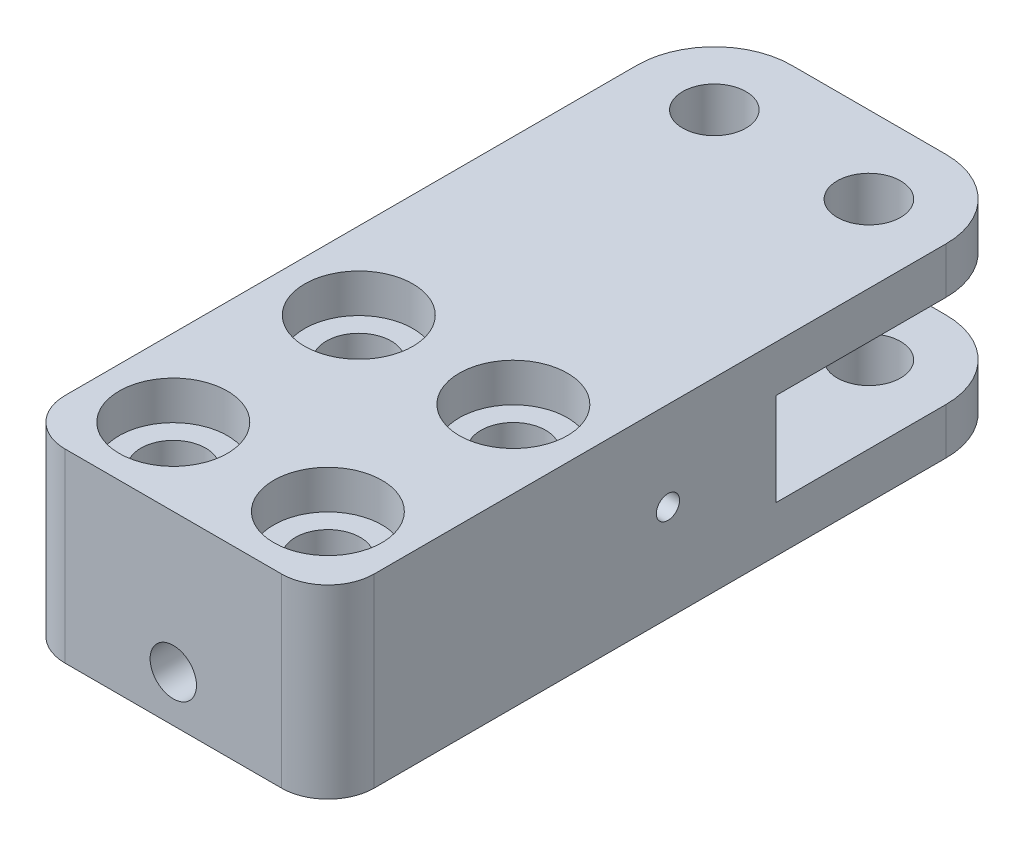
from build123d import *

# Parameters (mm, degrees)
BOSS_EXTRUDE1_START = 11
SKETCH1_W           = 20
SKETCH1_H           = 45
BOSS_EXTRUDE1_DEPTH = 12
SKETCH2_R           = 2.1
CUT_EXTRUDE1_DEPTH  = 16
SKETCH3_W           = 16
SKETCH3_H           = 6
CUT_EXTRUDE2_DEPTH  = 20
SKETCH4_R           = 2.05
CUT_EXTRUDE3_DEPTH  = 13
FILLET1_R           = 5
SKETCH5_R           = 3.5
CUT_EXTRUDE4_DEPTH  = 2.5
FILLET2_R           = 3
SKETCH6_W           = 3.5
SKETCH6_H           = 17
CUT_EXTRUDE5_DEPTH  = 9
SKETCH7_R           = 0.75
CUT_EXTRUDE6_DEPTH  = 20
SKETCH8_R           = 1.5
CUT_EXTRUDE7_DEPTH  = 18


with BuildPart() as part:
    # Sketch1 → Boss-Extrude1 (new body)
    with BuildSketch(Plane(origin=(0, 0, 0), x_dir=(1, 0, 0), z_dir=(0, 1, 0)).offset(BOSS_EXTRUDE1_START)):
        with Locations((0, -544.5)):
            Rectangle(SKETCH1_W, SKETCH1_H)
    extrude(amount=BOSS_EXTRUDE1_DEPTH)

    # Sketch2 → Cut-Extrude1 (cut)
    with BuildSketch(Plane(origin=(0, 23, 0), x_dir=(1, 0, 0), z_dir=(0, 1, 0))):
        with Locations((-5, -562)):
            Circle(SKETCH2_R)
        with Locations((5, -562)):
            Circle(SKETCH2_R)
        with Locations((-5, -550)):
            Circle(SKETCH2_R)
        with Locations((5, -550)):
            Circle(SKETCH2_R)
    extrude(amount=-CUT_EXTRUDE1_DEPTH, mode=Mode.SUBTRACT)

    # Sketch3 → Cut-Extrude2 (cut)
    with BuildSketch(Plane(origin=(10, 0, 0), x_dir=(0, 0, -1), z_dir=(1, 0, 0))):
        with Locations((-530, 17)):
            Rectangle(SKETCH3_W, SKETCH3_H)
    extrude(amount=-CUT_EXTRUDE2_DEPTH, mode=Mode.SUBTRACT)

    # Sketch4 → Cut-Extrude3 (cut)
    with BuildSketch(Plane(origin=(0, 23, 0), x_dir=(1, 0, 0), z_dir=(0, 1, 0))):
        with Locations((-5, -527)):
            Circle(SKETCH4_R)
        with Locations((5, -527)):
            Circle(SKETCH4_R)
    extrude(amount=-CUT_EXTRUDE3_DEPTH, mode=Mode.SUBTRACT)

    # Fillet1
    fillet1_edges = [part.edges().sort_by_distance(p)[0] for p in [
        (10, 12.5, 522),
        (10, 21.5, 522),
        (-10, 12.5, 522),
        (-10, 21.5, 522),
    ]]
    fillet(fillet1_edges, radius=FILLET1_R)

    # Sketch5 → Cut-Extrude4 (cut)
    with BuildSketch(Plane(origin=(0, 23, 0), x_dir=(1, 0, 0), z_dir=(0, 1, 0))):
        with Locations((-5, -550)):
            Circle(SKETCH5_R)
        with Locations((5, -550)):
            Circle(SKETCH5_R)
        with Locations((-5, -562)):
            Circle(SKETCH5_R)
        with Locations((5, -562)):
            Circle(SKETCH5_R)
    extrude(amount=-CUT_EXTRUDE4_DEPTH, mode=Mode.SUBTRACT)

    # Fillet2
    fillet2_edges = [part.edges().sort_by_distance(p)[0] for p in [
        (10, 17, 567),
        (-10, 17, 567),
    ]]
    fillet(fillet2_edges, radius=FILLET2_R)

    # Sketch6 → Cut-Extrude5 (cut)
    with BuildSketch(Plane.XZ.offset(-11)):
        with Locations((0, 540.5)):
            Rectangle(SKETCH6_W, SKETCH6_H)
    extrude(amount=-CUT_EXTRUDE5_DEPTH, mode=Mode.SUBTRACT)

    # Sketch7 → Cut-Extrude6 (cut)
    with BuildSketch(Plane.ZY.offset(10)):
        with Locations((545, 17.25)):
            Circle(SKETCH7_R)
    extrude(amount=-CUT_EXTRUDE6_DEPTH, mode=Mode.SUBTRACT)

    # Sketch8 → Cut-Extrude7 (cut)
    with BuildSketch(Plane.XY.offset(567)):
        with Locations((0, 14)):
            Circle(SKETCH8_R)
    extrude(amount=-CUT_EXTRUDE7_DEPTH, mode=Mode.SUBTRACT)


solid = part.part
